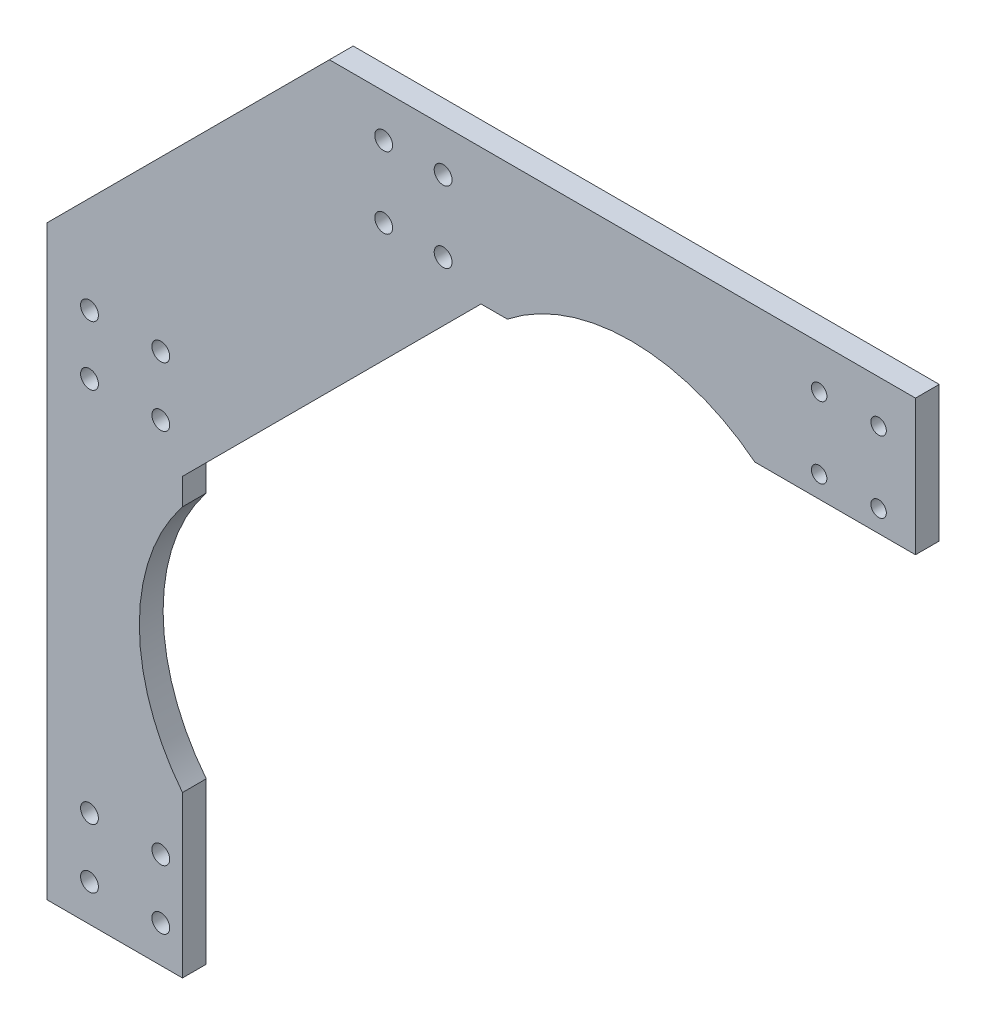
from build123d import *

# Parameters (mm, degrees)
BOSS_EXTRUDE1_DEPTH = 4
SKETCH3_R           = 1.5
SKETCH3_R_2         = 1.3
CUT_EXTRUDE1_DEPTH  = 10


with BuildPart() as part:
    # Sketch1 → Boss-Extrude1 (new body)
    with BuildSketch(Plane.XY):
        with BuildLine():
            Line((-98.326295957, -47.840468239), (-75.492445719, -47.840468239))
            Line((-75.492445719, -47.840468239), (-75.492445719, -20.816086355))
            ThreePointArc((-75.492445719, -20.816086355), (-82.750542947, 0), (-75.492445719, 20.816086355))
            Line((-75.492445719, 20.816086355), (-75.492445719, 25.252811288))
            Line((-75.492445719, 25.252811288), (-25.252811288, 75.492445719))
            Line((-25.252811288, 75.492445719), (-20.816086355, 75.492445719))
            ThreePointArc((-20.816086355, 75.492445719), (0, 82.750542947), (20.816086355, 75.492445719))
            Line((20.816086355, 75.492445719), (47.840468239, 75.492445719))
            Line((47.840468239, 75.492445719), (47.840468239, 98.326295957))
            Line((47.840468239, 98.326295957), (-50.769001995, 98.326295957))
            Line((-50.769001995, 98.326295957), (-98.326295957, 50.769001995))
            Line((-98.326295957, 50.769001995), (-98.326295957, -47.840468239))
        make_face()
    extrude(amount=BOSS_EXTRUDE1_DEPTH)

    # Sketch3 → Cut-Extrude1 (cut)
    with BuildSketch(Plane.XY.offset(4)):
        with Locations((-91.135133224, -41.635923431)):
            Circle(SKETCH3_R)
        with Locations((-91.135133224, -31.635923431)):
            Circle(SKETCH3_R)
        with Locations((-79.135133224, -31.635923431)):
            Circle(SKETCH3_R)
        with Locations((-79.135133224, -41.635923431)):
            Circle(SKETCH3_R)
        with Locations((-91.135133224, 31.635923431)):
            Circle(SKETCH3_R)
        with Locations((-91.135133224, 41.635923431)):
            Circle(SKETCH3_R)
        with Locations((-79.135133224, 41.635923431)):
            Circle(SKETCH3_R)
        with Locations((-79.135133224, 31.635923431)):
            Circle(SKETCH3_R)
        with Locations((31.635923431, 79.135133224)):
            Circle(SKETCH3_R_2)
        with Locations((31.635923431, 91.135133224)):
            Circle(SKETCH3_R_2)
        with Locations((41.635923431, 91.135133224)):
            Circle(SKETCH3_R_2)
        with Locations((41.635923431, 79.135133224)):
            Circle(SKETCH3_R_2)
        with Locations((-31.635923431, 79.135133224)):
            Circle(SKETCH3_R)
        with Locations((-31.635923431, 91.135133224)):
            Circle(SKETCH3_R)
        with Locations((-41.635923431, 91.135133224)):
            Circle(SKETCH3_R)
        with Locations((-41.635923431, 79.135133224)):
            Circle(SKETCH3_R)
    extrude(amount=-CUT_EXTRUDE1_DEPTH, mode=Mode.SUBTRACT)


solid = part.part
